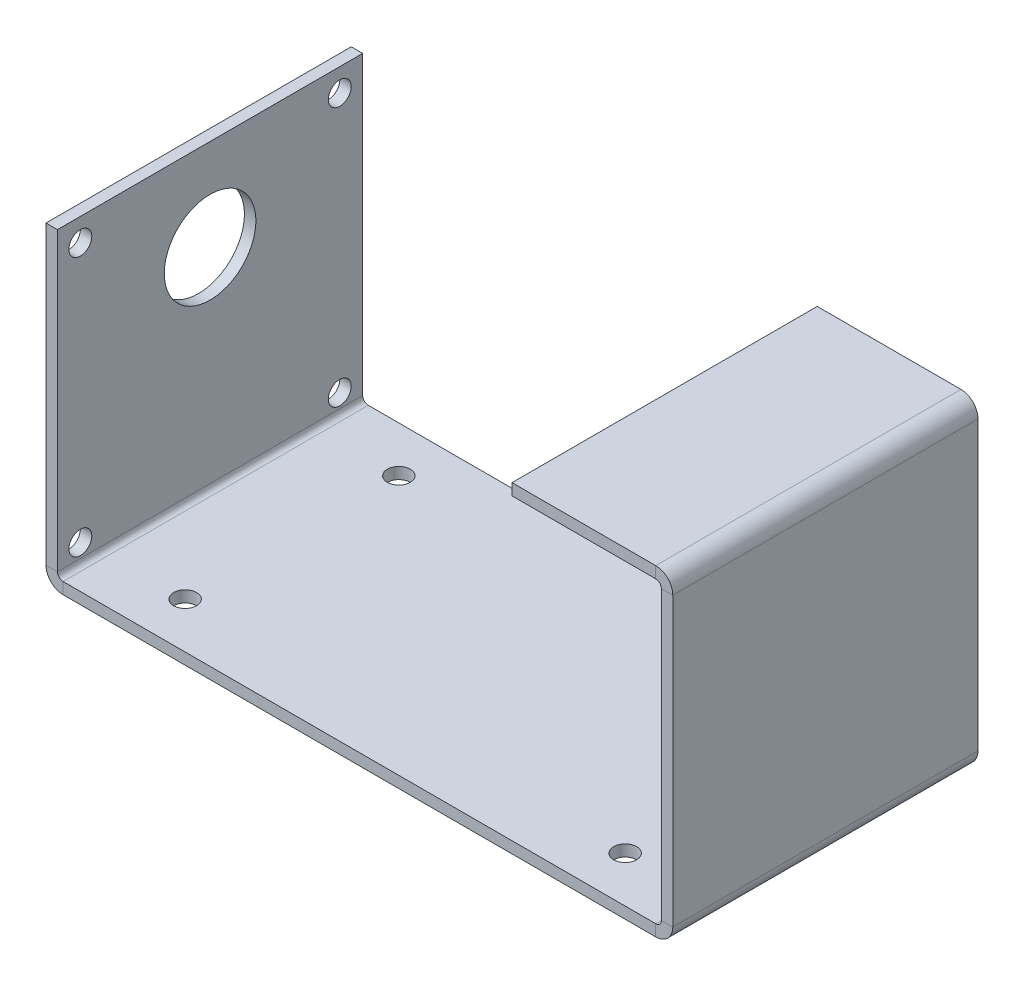
from build123d import *
from build123d.topology import SkipClean

# Parameters (mm, degrees)
SKETCH1_R                       = 6
SKETCH1_R_2                     = 1.5
BASE_FLANGE2_DEPTH              = 1.5
SKETCHED_START                  = -40
SKETCHED_BEND1_DEPTH            = 40
SKETCHED_BEND1_2_DEPTH          = 40
SKETCHED_START_2                = -35.4999999
SKETCHED_BEND1_3_DEPTH          = 9.4999998
SKETCHED_START_3                = -13.9999999
SKETCHED_BEND1_4_DEPTH          = 9.4999998
SKETCHED_BEND1_5_DEPTH          = 1.4999999
SKETCHED_START_4                = -1.4999999
SKETCHED_BEND1_6_DEPTH          = 1.4999999
SKETCHED_START_5                = 38.93097291
SKETCHED_BEND1_7_DEPTH          = 1.5
SKETCHED_START_6                = 40.43097291
SKETCHED_BEND1_8_DEPTH          = 0.618240168
SKETCHED_START_7                = -38.5000001
SKETCHED_BEND1_9_DEPTH          = 37.00000011
SKETCHED_BEND1_10_DEPTH         = 37.00000011
F_3_0MM_PRESS_DOWEL_HOLE1_D     = 3
F_3_0MM_PRESS_DOWEL_HOLE1_DEPTH = 1.5
F_3_0MM_PRESS_DOWEL_HOLE2_D     = 3
F_3_0MM_PRESS_DOWEL_HOLE2_DEPTH = 6
F_3_0MM_PRESS_DOWEL_HOLE2_TIP   = 0.901290929
F_3_0MM_PRESS_DOWEL_HOLE3_D     = 3
F_3_0MM_PRESS_DOWEL_HOLE3_DEPTH = 6
F_3_0MM_PRESS_DOWEL_HOLE3_TIP   = 0.901290929


with BuildPart() as part:
    # Base-Flange2: sheet metal written as solids
    # Sketch1 → Base-Flange2 (new body)
    with BuildSketch(Plane(origin=(0, 0, 0), x_dir=(1, 0, 0), z_dir=(0, 1, 0))):
        Polygon((0, 0), (40, 0), (120, 0), (160, 0), (180, 0), (180, 40), (160, 40), (120, 40), (40, 40), (0, 40), align=None)
        with Locations(Location((12, 20, 0), (0, 0, 270))):
            Circle(SKETCH1_R, mode=Mode.SUBTRACT)
        with Locations(Location((3, 37, 0), (0, 0, 270))):
            Circle(SKETCH1_R_2, mode=Mode.SUBTRACT)
        with Locations(Location((37, 37, 0), (0, 0, 270))):
            Circle(SKETCH1_R_2, mode=Mode.SUBTRACT)
        with Locations(Location((37, 3, 0), (0, 0, 270))):
            Circle(SKETCH1_R_2, mode=Mode.SUBTRACT)
        with Locations(Location((3, 3, 0), (0, 0, 270))):
            Circle(SKETCH1_R_2, mode=Mode.SUBTRACT)
    extrude(amount=-BASE_FLANGE2_DEPTH)

    # Sketched Bend1: read off the stored shape, not the designer's step
    # Sketched Bend1 outline → Sketched Bend1 (cut)
    with BuildSketch(Plane.XY.offset(SKETCHED_START)):
        with BuildLine():
            Line((180, 0), (120.944250946, 0))
            ThreePointArc((120.944250946, 0), (120.127591172, -1.086838938), (118.83242709, -1.5))
            Line((118.83242709, -1.5), (180, -1.5))
            Line((180, -1.5), (180, 0))
        make_face()
        with BuildLine():
            Line((0, -1.5), (41.16757291, -1.5))
            ThreePointArc((41.16757291, -1.5), (39.872408828, -1.086838938), (39.055749054, 0))
            Line((39.055749054, 0), (0, 0))
            Line((0, 0), (0, -1.5))
        make_face()
    extrude(amount=SKETCHED_BEND1_DEPTH, mode=Mode.SUBTRACT)

    # Sketched Bend1 2 outline → Sketched Bend1 2 (add)
    with BuildSketch(Plane.XY.offset(SKETCHED_START)):
        with BuildLine():
            ThreePointArc((120.944250946, 0), (121.037612433, 0.363053267), (121.06902709, 0.7366))
            Line((121.06902709, 0.7366), (121.06902709, 38.401454181))
            ThreePointArc((121.06902709, 38.401454181), (120.413942116, 39.982969207), (118.83242709, 40.638054181))
            Line((118.83242709, 40.638054181), (100, 40.638054181))
            Line((100, 40.638054181), (100, 39.138054181))
            Line((100, 39.138054181), (118.83242709, 39.138054181))
            ThreePointArc((118.83242709, 39.138054181), (119.353281945, 38.922309036), (119.56902709, 38.401454181))
            Line((119.56902709, 38.401454181), (119.56902709, 0.7366))
            ThreePointArc((119.56902709, 0.7366), (119.353281945, 0.215745145), (118.83242709, 0))
            Line((118.83242709, 0), (120.944250946, 0))
        make_face()
    extrude(amount=SKETCHED_BEND1_2_DEPTH)

    # Sketched Bend1 3 outline → Sketched Bend1 3 (add)
    with BuildSketch(Plane.XY.offset(SKETCHED_START_2)):
        with BuildLine():
            Line((39.055749054, 0), (41.16757291, 0))
            ThreePointArc((41.16757291, 0), (40.646718055, 0.215745145), (40.43097291, 0.7366))
            Line((40.43097291, 0.7366), (40.43097291, 39.56902709))
            Line((40.43097291, 39.56902709), (38.93097291, 39.56902709))
            Line((38.93097291, 39.56902709), (38.93097291, 0.7366))
            ThreePointArc((38.93097291, 0.7366), (38.962387567, 0.363053267), (39.055749054, 0))
        make_face()
    extrude(amount=SKETCHED_BEND1_3_DEPTH)

    # Sketched Bend1 4 outline → Sketched Bend1 4 (add)
    with BuildSketch(Plane.XY.offset(SKETCHED_START_3)):
        with BuildLine():
            Line((39.055749054, 0), (41.16757291, 0))
            ThreePointArc((41.16757291, 0), (40.646718055, 0.215745145), (40.43097291, 0.7366))
            Line((40.43097291, 0.7366), (40.43097291, 39.56902709))
            Line((40.43097291, 39.56902709), (38.93097291, 39.56902709))
            Line((38.93097291, 39.56902709), (38.93097291, 0.7366))
            ThreePointArc((38.93097291, 0.7366), (38.962387567, 0.363053267), (39.055749054, 0))
        make_face()
    extrude(amount=SKETCHED_BEND1_4_DEPTH)

    # Sketched Bend1 5 outline → Sketched Bend1 5 (add)
    with BuildSketch(Plane.XY.offset(SKETCHED_START)):
        with BuildLine():
            Line((39.055749054, 0), (41.16757291, 0))
            ThreePointArc((41.16757291, 0), (40.646718055, 0.215745145), (40.43097291, 0.7366))
            Line((40.43097291, 0.7366), (40.43097291, 39.56902709))
            Line((40.43097291, 39.56902709), (38.93097291, 39.56902709))
            Line((38.93097291, 39.56902709), (38.93097291, 0.7366))
            ThreePointArc((38.93097291, 0.7366), (38.962387567, 0.363053267), (39.055749054, 0))
        make_face()
    extrude(amount=SKETCHED_BEND1_5_DEPTH)

    # Sketched Bend1 6 outline → Sketched Bend1 6 (add)
    with BuildSketch(Plane.XY.offset(SKETCHED_START_4)):
        with BuildLine():
            Line((39.055749054, 0), (41.16757291, 0))
            ThreePointArc((41.16757291, 0), (40.646718055, 0.215745145), (40.43097291, 0.7366))
            Line((40.43097291, 0.7366), (40.43097291, 39.56902709))
            Line((40.43097291, 39.56902709), (38.93097291, 39.56902709))
            Line((38.93097291, 39.56902709), (38.93097291, 0.7366))
            ThreePointArc((38.93097291, 0.7366), (38.962387567, 0.363053267), (39.055749054, 0))
        make_face()
    extrude(amount=SKETCHED_BEND1_6_DEPTH)

    # Sketched Bend1 7 outline → Sketched Bend1 7 (add)
    with BuildSketch(Plane.YZ.offset(SKETCHED_START_5)):
        with BuildLine():
            Line((36.56902709, -38.5), (39.56902709, -38.5000001))
            Line((39.56902709, -38.5000001), (39.56902709, -35.4999999))
            Line((39.56902709, -35.4999999), (36.56902709, -35.5))
            ThreePointArc((36.56902709, -35.5), (38.06902709, -37), (36.56902709, -38.5))
        make_face()
        with BuildLine():
            Line((2.569027031, -38.5), (36.56902709, -38.5))
            ThreePointArc((36.56902709, -38.5), (35.06902709, -37), (36.56902709, -35.5))
            Line((36.56902709, -35.5), (2.56902709, -35.5))
            ThreePointArc((2.56902709, -35.5), (4.06902709, -37.000000029), (2.569027031, -38.5))
        make_face()
        with BuildLine():
            Line((27.56902709, -26), (39.56902709, -26.0000001))
            Line((39.56902709, -26.0000001), (39.56902709, -13.9999999))
            Line((39.56902709, -13.9999999), (27.56902709, -14))
            ThreePointArc((27.56902709, -14), (33.56902709, -20), (27.56902709, -26))
        make_face()
        with BuildLine():
            Line((0, -38.5000001), (2.569027031, -38.5))
            ThreePointArc((2.569027031, -38.5), (1.06902709, -36.999999971), (2.56902709, -35.5))
            Line((2.56902709, -35.5), (0, -35.4999999))
            Line((0, -35.4999999), (0, -38.5000001))
        make_face()
        with BuildLine():
            Line((0, -26.0000001), (27.56902709, -26))
            ThreePointArc((27.56902709, -26), (21.56902709, -20), (27.56902709, -14))
            Line((27.56902709, -14), (0, -13.9999999))
            Line((0, -13.9999999), (0, -26.0000001))
        make_face()
        with BuildLine():
            Line((36.56902709, -4.5), (39.56902709, -4.5000001))
            Line((39.56902709, -4.5000001), (39.56902709, -1.4999999))
            Line((39.56902709, -1.4999999), (36.56902709, -1.5))
            ThreePointArc((36.56902709, -1.5), (38.06902709, -3), (36.56902709, -4.5))
        make_face()
        with BuildLine():
            Line((2.56902709, -4.5), (36.56902709, -4.5))
            ThreePointArc((36.56902709, -4.5), (35.06902709, -3), (36.56902709, -1.5))
            Line((36.56902709, -1.5), (2.569027095, -1.5))
            ThreePointArc((2.569027095, -1.5), (4.06902709, -3.000000002), (2.56902709, -4.5))
        make_face()
        with BuildLine():
            Line((0, -4.5000001), (2.56902709, -4.5))
            ThreePointArc((2.56902709, -4.5), (1.06902709, -2.999999998), (2.569027095, -1.5))
            Line((2.569027095, -1.5), (0, -1.4999999))
            Line((0, -1.4999999), (0, -4.5000001))
        make_face()
    extrude(amount=SKETCHED_BEND1_7_DEPTH)

    # Sketched Bend1 8 outline → Sketched Bend1 8 (add)
    with BuildSketch(Plane.YZ.offset(SKETCHED_START_6)):
        with BuildLine():
            Line((0, -38.5000001), (2.569027031, -38.5))
            ThreePointArc((2.569027031, -38.5), (1.06902709, -36.999999971), (2.56902709, -35.5))
            Line((2.56902709, -35.5), (0, -35.4999999))
            Line((0, -35.4999999), (0, -38.5000001))
        make_face()
        with BuildLine():
            Line((0, -26.0000001), (27.56902709, -26))
            ThreePointArc((27.56902709, -26), (21.56902709, -20), (27.56902709, -14))
            Line((27.56902709, -14), (0, -13.9999999))
            Line((0, -13.9999999), (0, -26.0000001))
        make_face()
        with BuildLine():
            Line((0, -4.5000001), (2.56902709, -4.5))
            ThreePointArc((2.56902709, -4.5), (1.06902709, -2.999999998), (2.569027095, -1.5))
            Line((2.569027095, -1.5), (0, -1.4999999))
            Line((0, -1.4999999), (0, -4.5000001))
        make_face()
    extrude(amount=SKETCHED_BEND1_8_DEPTH)

    # Sketched Bend1 9 outline → Sketched Bend1 9 (cut)
    with SkipClean():  # the faces are left unmerged after this step: merging them gives an invalid solid
        with BuildSketch(Plane.XY.offset(SKETCHED_START_7)):
            with BuildLine():
                ThreePointArc((40.43097291, 0.7366), (40.606429696, 0.259423037), (41.049213078, 0.009571452))
                Line((41.049213078, 0.009571452), (41.049213078, 27.56902709))
                Line((41.049213078, 27.56902709), (40.43097291, 27.56902709))
                Line((40.43097291, 27.56902709), (40.43097291, 0.7366))
            make_face()
            with BuildLine():
                ThreePointArc((39.055749054, 0), (38.962387567, 0.363053267), (38.93097291, 0.7366))
                Line((38.93097291, 0.7366), (38.93097291, 0))
                Line((38.93097291, 0), (39.055749054, 0))
            make_face()
        extrude(amount=SKETCHED_BEND1_9_DEPTH, mode=Mode.SUBTRACT)

    # Sketched Bend1 10 outline → Sketched Bend1 10 (add)
    with SkipClean():  # the faces are left unmerged after this step: merging them gives an invalid solid
        with BuildSketch(Plane.XY.offset(SKETCHED_START_7)):
            with BuildLine():
                ThreePointArc((41.16757291, 0), (41.108199805, 0.002396762), (41.049213078, 0.009571452))
                Line((41.049213078, 0.009571452), (41.049213078, 0))
                Line((41.049213078, 0), (41.16757291, 0))
            make_face()
        extrude(amount=SKETCHED_BEND1_10_DEPTH)

    # Ø3.0mm Press Dowel Hole1
    with Locations(Plane(origin=(0, 0, 0), x_dir=(1, 0, 0), z_dir=(0, 1, 0))):
        with Locations((108.83242709, 34), (108.83242709, 6), (51.16757291, 6), (51.16757291, 34)):
            Hole(F_3_0MM_PRESS_DOWEL_HOLE1_D / 2, depth=F_3_0MM_PRESS_DOWEL_HOLE1_DEPTH)

    # Ø3.0mm Press Dowel Hole2
    with Locations(Plane(origin=(-87.600386311, -7.5, 7.525513363), x_dir=(0, 0, -1), z_dir=(0, -1, 0))):
        with Locations((220.525513363, 156.531359221), (102.525513363, 181.531359221), (102.525513363, 271.531359221), (89.19270005, 226.531359221), (210.525513363, 317.793651488), (230.525513363, 317.793651488), (252.525513363, 320.462332131), (232.525513363, 300.462332131), (252.525513363, 132.600386311), (232.525513363, 152.600386311), (111.286271896, 136.531359221), (91.286271896, 136.531359221), (41.525513363, 196.432813402), (13.525513363, 196.432813402), (41.525513363, 138.767959221), (13.525513363, 138.767959221), (41.525513363, 256.62990504), (13.525513363, 256.62990504), (41.525513363, 314.294759221), (13.525513363, 314.294759221)):
            Hole(F_3_0MM_PRESS_DOWEL_HOLE2_D / 2, depth=F_3_0MM_PRESS_DOWEL_HOLE2_DEPTH)
            with Locations((0, 0, -(F_3_0MM_PRESS_DOWEL_HOLE2_DEPTH + F_3_0MM_PRESS_DOWEL_HOLE2_TIP / 2))):  # 118° drill point
                Cone(0, F_3_0MM_PRESS_DOWEL_HOLE2_D / 2, F_3_0MM_PRESS_DOWEL_HOLE2_TIP, mode=Mode.SUBTRACT)

    # Ø3.0mm Press Dowel Hole3
    with Locations(Plane(origin=(365.462332131, -7.5, -47.525513363), x_dir=(0, 0, 1), z_dir=(0, -1, 0))):
        with Locations((220.525513363, 156.531359221), (102.525513363, 181.531359221), (102.525513363, 271.531359221), (89.19270005, 226.531359221), (210.525513363, 317.793651488), (230.525513363, 317.793651488), (252.525513363, 320.462332131), (232.525513363, 300.462332131), (252.525513363, 132.600386311), (232.525513363, 152.600386311), (111.286271896, 136.531359221), (91.286271896, 136.531359221), (41.525513363, 196.432813402), (13.525513363, 196.432813402), (41.525513363, 138.767959221), (13.525513363, 138.767959221), (41.525513363, 256.62990504), (13.525513363, 256.62990504), (41.525513363, 314.294759221), (13.525513363, 314.294759221)):
            Hole(F_3_0MM_PRESS_DOWEL_HOLE3_D / 2, depth=F_3_0MM_PRESS_DOWEL_HOLE3_DEPTH)
            with Locations((0, 0, -(F_3_0MM_PRESS_DOWEL_HOLE3_DEPTH + F_3_0MM_PRESS_DOWEL_HOLE3_TIP / 2))):  # 118° drill point
                Cone(0, F_3_0MM_PRESS_DOWEL_HOLE3_D / 2, F_3_0MM_PRESS_DOWEL_HOLE3_TIP, mode=Mode.SUBTRACT)


solid = part.part
